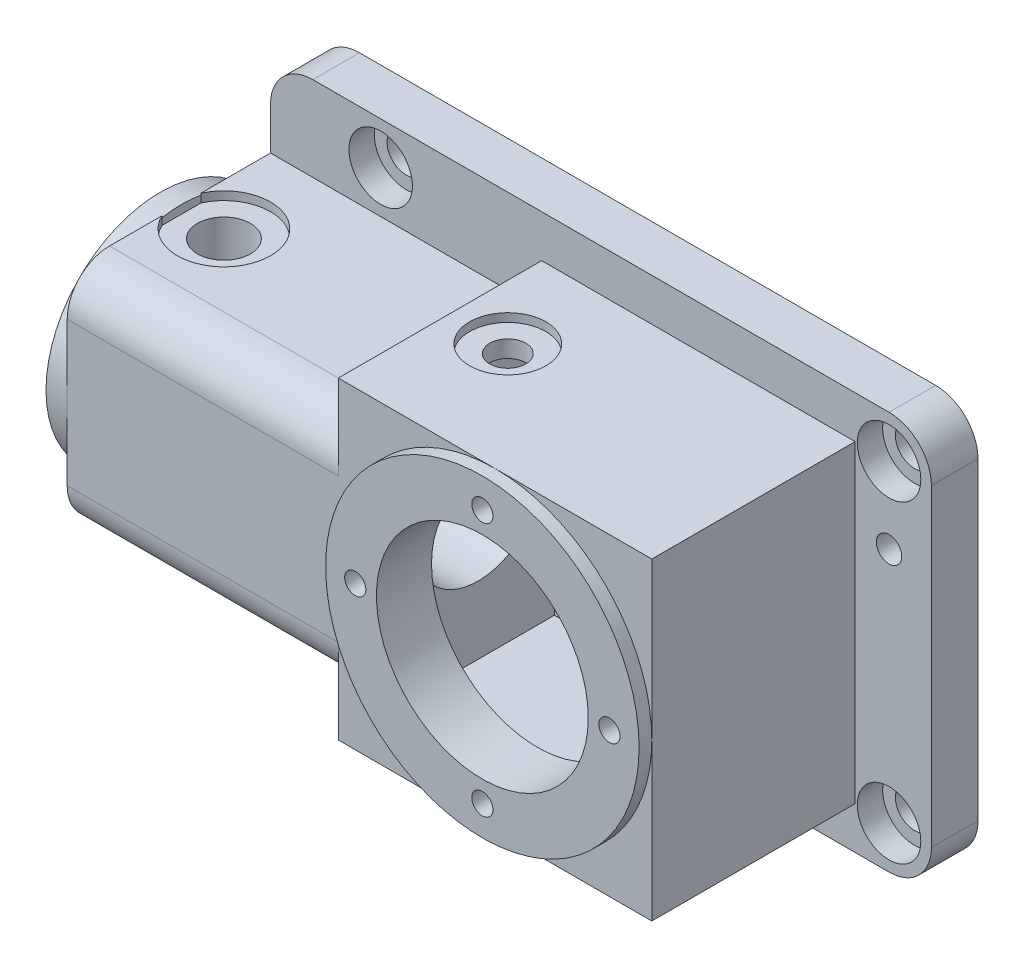
from build123d import *

# Parameters (mm, degrees)
EXTRUDE_1_DEPTH             = 11
EXTRUDE_START               = -11
SKETCH_2_W                  = 74
SKETCH_2_H                  = 74
EXTRUDE_2_DEPTH             = 59
SKETCH_3_W                  = 48
SKETCH_3_H                  = 54
EXTRUDE_3_DEPTH             = 64
SKETCH_4_R                  = 27
EXTRUDE_4_DEPTH             = 5
FILLET_1_R                  = 10
SKETCH_7_R                  = 7.5
CUT_EXTRUDE_1_DEPTH         = 6
SKETCH_8_R                  = 4.5
CUT_EXTRUDE_2_DEPTH         = 128.910124697
SKETCH_9_R                  = 3
CUT_EXTRUDE_3_DEPTH         = 126.495019822
CUT_EXTRUDE_4_DEPTH         = 4
SKETCH_11_R                 = 37
EXTRUDE_5_DEPTH             = 3
CUT_EXTRUDE_START           = -45
SKETCH_14_W                 = 62
SKETCH_14_H                 = 62
CUT_EXTRUDE_6_DEPTH         = 35
SKETCH_13_R                 = 21
CUT_EXTRUDE_5_DEPTH         = 12
SKETCH_15_R                 = 23
SKETCH_15_R_2               = 21
EXTRUDE_6_DEPTH             = 12
CHAMFER_1_SIZE              = 2
CUT_EXTRUDE_7_REACH         = 133.488
SKETCH_12_R                 = 25
CUT_EXTRUDE_8_REACH         = 180.813
SKETCH_17_R                 = 15
CUT_EXTRUDE_9_DEPTH         = 2
M14X1_5_1_REACH             = 144.352
M14X1_5_1_BORE_R            = 6.25
HOLE_WIZARD_M6_1_D          = 5
HOLE_WIZARD_M6_1_DEPTH      = 10.497848452
HOLE_WIZARD_M6_1_TIP        = 1.502151548
SKETCH_25_R                 = 9
CUT_EXTRUDE_10_DEPTH        = 2
HOLE_START                  = 31
HOLE_WIZARD_M10_1_OUTLINE_R = 4.25
HOLE_WIZARD_M10_1_DEPTH     = 4
CUT_EXTRUDE_11_DEPTH        = 6


# Read off the part's stored shape, not the designer's step: M6 螺纹孔2, M10 螺纹孔1
with BuildPart() as part:
    # 草图1 → 凸台-拉伸1 (new body)
    with BuildSketch(Plane.XY):
        with BuildLine():
            Line((-91, -47), (45, -47))
            ThreePointArc((45, -47), (52.071067812, -44.071067812), (55, -37))
            Line((55, -37), (55, 37))
            ThreePointArc((55, 37), (52.071067812, 44.071067812), (45, 47))
            Line((45, 47), (-91, 47))
            ThreePointArc((-91, 47), (-98.071067812, 44.071067812), (-101, 37))
            Line((-101, 37), (-101, -37))
            ThreePointArc((-101, -37), (-98.071067812, -44.071067812), (-91, -47))
        make_face()
    extrude(amount=EXTRUDE_1_DEPTH)

    # 草图2 → 凸台-拉伸2 (add)
    with BuildSketch(Plane.XY.offset(11).offset(EXTRUDE_START)):
        Rectangle(SKETCH_2_W, SKETCH_2_H)
    extrude(amount=EXTRUDE_2_DEPTH)

    # 草图3 → 凸台-拉伸3 (add)
    with BuildSketch(Plane.ZY.offset(37)):
        with Locations((35, 0)):
            Rectangle(SKETCH_3_W, SKETCH_3_H)
    extrude(amount=EXTRUDE_3_DEPTH)

    # 草图4 → 凸台-拉伸4 (add)
    with BuildSketch(Plane.ZY.offset(101)):
        with Locations((32, 0)):
            Circle(SKETCH_4_R)
    extrude(amount=EXTRUDE_4_DEPTH)

    # 圆角1
    fillet_1_edges = [part.edges().sort_by_distance(p)[0] for p in [
        (-69, 27, 59),
        (-69, -27, 59),
    ]]
    fillet(fillet_1_edges, radius=FILLET_1_R)

    # 草图7 → 切除-拉伸1 (cut)
    with BuildSketch(Plane.XY.offset(11)):
        with Locations((45, 37)):
            Circle(SKETCH_7_R)
        with Locations((-75, 37)):
            Circle(SKETCH_7_R)
    cut_extrude_1 = extrude(amount=-CUT_EXTRUDE_1_DEPTH, mode=Mode.SUBTRACT)

    # 草图8 → 切除-拉伸2 (cut, through all)
    with BuildSketch(Plane.XY.offset(5)):
        with Locations((45, 37)):
            Circle(SKETCH_8_R)
        with Locations((-75, 37)):
            Circle(SKETCH_8_R)
    cut_extrude_2 = extrude(amount=-CUT_EXTRUDE_2_DEPTH, mode=Mode.SUBTRACT)

    # 镜向1: 切除-拉伸1, 切除-拉伸2 across plane
    add(cut_extrude_1.mirror(Plane.ZX), mode=Mode.SUBTRACT)
    add(cut_extrude_2.mirror(Plane.ZX), mode=Mode.SUBTRACT)

    # 草图9 → 切除-拉伸3 (cut, through all)
    with BuildSketch(Plane.XY.offset(11)):
        with Locations((45, 19)):
            Circle(SKETCH_9_R)
        with Locations((-57, -37)):
            Circle(SKETCH_9_R)
    extrude(amount=-CUT_EXTRUDE_3_DEPTH, mode=Mode.SUBTRACT)

    # 草图5 → 切除-拉伸4 (cut)
    with BuildSketch(Plane(origin=(0, 0, 0), x_dir=(-1, 0, 0), z_dir=(0, 0, -1))):
        with BuildLine():
            ThreePointArc((65, 37), (67.928932188, 29.928932188), (75, 27))
            Line((75, 27), (91, 27))
            Line((91, 27), (91, -27))
            Line((91, -27), (57, -27))
            ThreePointArc((57, -27), (49.928932188, -29.928932188), (47, -37))
            Line((47, -37), (-35, -37))
            ThreePointArc((-35, -37), (-37.928932188, -29.928932188), (-45, -27))
            Line((-45, -27), (-45, 9))
            ThreePointArc((-45, 9), (-37.928932188, 11.928932188), (-35, 19))
            Line((-35, 19), (-35, 37))
            Line((-35, 37), (65, 37))
        make_face()
    extrude(amount=-CUT_EXTRUDE_4_DEPTH, mode=Mode.SUBTRACT)

    # 草图11 → 凸台-拉伸5 (add)
    with BuildSketch(Plane.XY.offset(59)):
        Circle(SKETCH_11_R)
    extrude(amount=EXTRUDE_5_DEPTH)

    # 草图14 → 切除-拉伸6 (cut)
    with BuildSketch(Plane(origin=(0, 0, 4), x_dir=(-1, 0, 0), z_dir=(0, 0, -1)).offset(CUT_EXTRUDE_START)):
        Rectangle(SKETCH_14_W, SKETCH_14_H)
    extrude(amount=CUT_EXTRUDE_6_DEPTH, mode=Mode.SUBTRACT)

    # 草图13 → 切除-拉伸5 (cut)
    with BuildSketch(Plane(origin=(0, 0, 4), x_dir=(-1, 0, 0), z_dir=(0, 0, -1))):
        Circle(SKETCH_13_R)
    extrude(amount=-CUT_EXTRUDE_5_DEPTH, mode=Mode.SUBTRACT)

    # 草图15 → 凸台-拉伸6 (add)
    with BuildSketch(Plane(origin=(0, 0, 4), x_dir=(-1, 0, 0), z_dir=(0, 0, -1))):
        Circle(SKETCH_15_R)
        Circle(SKETCH_15_R_2, mode=Mode.SUBTRACT)
    extrude(amount=-EXTRUDE_6_DEPTH)

    # 倒角1
    chamfer_1_edges = [part.edges().sort_by_distance(p)[0] for p in [
        (21, 0, 16),
    ]]
    chamfer(chamfer_1_edges, length=CHAMFER_1_SIZE - 0.0001)  # a hair under: the kernel refuses the full size

    # 草图12 → 切除-拉伸7 (cut, up to next)
    with BuildSketch(Plane.XY.offset(62), mode=Mode.PRIVATE) as cut_extrude_7_sk1:
        Circle(SKETCH_12_R)
    cut_extrude_7_tool1 = extrude(cut_extrude_7_sk1.sketch, amount=-CUT_EXTRUDE_7_REACH, mode=Mode.PRIVATE) & part.part
    add(cut_extrude_7_tool1.solids().sort_by_distance((0, 0, 62))[0], mode=Mode.SUBTRACT)

    # 草图17 → 切除-拉伸8 (cut, up to next)
    with BuildSketch(Plane.ZY.offset(106), mode=Mode.PRIVATE) as cut_extrude_8_sk1:
        with Locations((32, 0)):
            Circle(SKETCH_17_R)
    cut_extrude_8_tool1 = extrude(cut_extrude_8_sk1.sketch, amount=-CUT_EXTRUDE_8_REACH, mode=Mode.PRIVATE) & part.part
    add(cut_extrude_8_tool1.solids().sort_by_distance((-106, 0, 32))[0], mode=Mode.SUBTRACT)

    # 草图18 → 切除-拉伸9 (cut)
    with BuildSketch(Plane.XZ.offset(27)):
        with BuildLine():
            Line((-101, 36.582575695), (-101, 32))
            Line((-101, 32), (-101, 27.417424305))
            ThreePointArc((-101, 27.417424305), (-80, 32), (-101, 36.582575695))
        make_face()
    cut_extrude_9 = extrude(amount=-CUT_EXTRUDE_9_DEPTH, mode=Mode.SUBTRACT)

    # M14x1.5 螺纹孔1 bore → M14x1.5 螺纹孔1 (cut, up to next)
    with BuildSketch(Plane.XZ.offset(25), mode=Mode.PRIVATE) as m14x1_5_1_sk1:
        with Locations((-91, 32)):
            Circle(M14X1_5_1_BORE_R)
    m14x1_5_1_tool1 = extrude(m14x1_5_1_sk1.sketch, amount=-M14X1_5_1_REACH, mode=Mode.PRIVATE) & part.part
    m14x1_5_1 = m14x1_5_1_tool1.solids().sort_by_distance((-91, -25, 32))[0]
    add(m14x1_5_1, mode=Mode.SUBTRACT)

    # 镜向2: 切除-拉伸9, M14x1.5 螺纹孔1 across plane
    add(cut_extrude_9.mirror(Plane.ZX), mode=Mode.SUBTRACT)
    add(m14x1_5_1.mirror(Plane.ZX), mode=Mode.SUBTRACT)

    # M6 螺纹孔1
    with Locations(Plane.XY.offset(62)):
        with Locations((30, 0), (0, -30), (-30, 0), (0, 30)):
            Hole(HOLE_WIZARD_M6_1_D / 2, depth=HOLE_WIZARD_M6_1_DEPTH)
            with Locations((0, 0, -(HOLE_WIZARD_M6_1_DEPTH + HOLE_WIZARD_M6_1_TIP / 2))):  # 118° drill point
                Cone(0, HOLE_WIZARD_M6_1_D / 2, HOLE_WIZARD_M6_1_TIP, mode=Mode.SUBTRACT)

    # M6 螺纹孔2 outline → M6 螺纹孔2 (revolve, cut)
    with BuildSketch(Plane(origin=(0, 17.320508076, 22), x_dir=(0, 1, 0), z_dir=(0, 0, -1))):
        Polygon((2.5, -92.502151548), (0, -91), (0, -106), (2.5, -106), align=None)
    revolve(axis=Axis((0, 17.320508076, 22), (1, 0, 0)), mode=Mode.SUBTRACT)

    # Hole Wizard M6 _2 2 outline → Hole Wizard M6 _2 2 (revolve, cut)
    with BuildSketch(Plane(origin=(0, -17.320508076, 22), x_dir=(0, 1, 0), z_dir=(0, 0, -1))):
        Polygon((2.5, -92.502151548), (0, -91), (0, -106), (2.5, -106), align=None)
    revolve(axis=Axis((0, -17.320508076, 22), (1, 0, 0)), mode=Mode.SUBTRACT)

    # Hole Wizard M6 _2 3 outline → Hole Wizard M6 _2 3 (revolve, cut)
    with BuildSketch(Plane.YX.offset(-52)):
        Polygon((2.5, -92.502151548), (0, -91), (0, -106), (2.5, -106), align=None)
    revolve(axis=Axis((0, 0, 52), (1, 0, 0)), mode=Mode.SUBTRACT)

    # 草图25 → 切除-拉伸10 (cut)
    with BuildSketch(Plane(origin=(0, 37, 0), x_dir=(1, 0, 0), z_dir=(0, 1, 0))):
        with Locations(Location((-24, -32, 0), (0, 0, 270))):
            Circle(SKETCH_25_R)
    extrude(amount=-CUT_EXTRUDE_10_DEPTH, mode=Mode.SUBTRACT)

    # M10 螺纹孔1 outline → M10 螺纹孔1 (cut)
    with BuildSketch(Plane(origin=(0, 0, 0), x_dir=(1, 0, 0), z_dir=(0, 1, 0)).offset(HOLE_START)):
        with Locations((-24, -32)):
            Circle(HOLE_WIZARD_M10_1_OUTLINE_R)
    extrude(amount=HOLE_WIZARD_M10_1_DEPTH, mode=Mode.SUBTRACT)

    # 草图16 → 切除-拉伸11 (cut)
    with BuildSketch(Plane(origin=(0, 0, 49), x_dir=(-1, 0, 0), z_dir=(0, 0, -1))):
        with BuildLine():
            Line((31, 31), (12, 31))
            Line((12, 31), (12, 27.49545417))
            ThreePointArc((12, 27.49545417), (21.213203436, 21.213203436), (27.49545417, 12))
            Line((27.49545417, 12), (31, 12))
            Line((31, 12), (31, 31))
        make_face()
        with BuildLine():
            Line((31, -31), (12, -31))
            Line((12, -31), (12, -27.49545417))
            ThreePointArc((12, -27.49545417), (21.213203436, -21.213203436), (27.49545417, -12))
            Line((27.49545417, -12), (31, -12))
            Line((31, -12), (31, -31))
        make_face()
        with BuildLine():
            Line((-31, 31), (-31, 12))
            Line((-31, 12), (-27.49545417, 12))
            ThreePointArc((-27.49545417, 12), (-21.213203436, 21.213203436), (-12, 27.49545417))
            Line((-12, 27.49545417), (-12, 31))
            Line((-12, 31), (-31, 31))
        make_face()
        with BuildLine():
            Line((-27.49545417, -12), (-31, -12))
            Line((-31, -12), (-31, -31))
            Line((-31, -31), (-12, -31))
            Line((-12, -31), (-12, -27.49545417))
            ThreePointArc((-12, -27.49545417), (-21.213203436, -21.213203436), (-27.49545417, -12))
        make_face()
    extrude(amount=-CUT_EXTRUDE_11_DEPTH, mode=Mode.SUBTRACT)


solid = part.part
